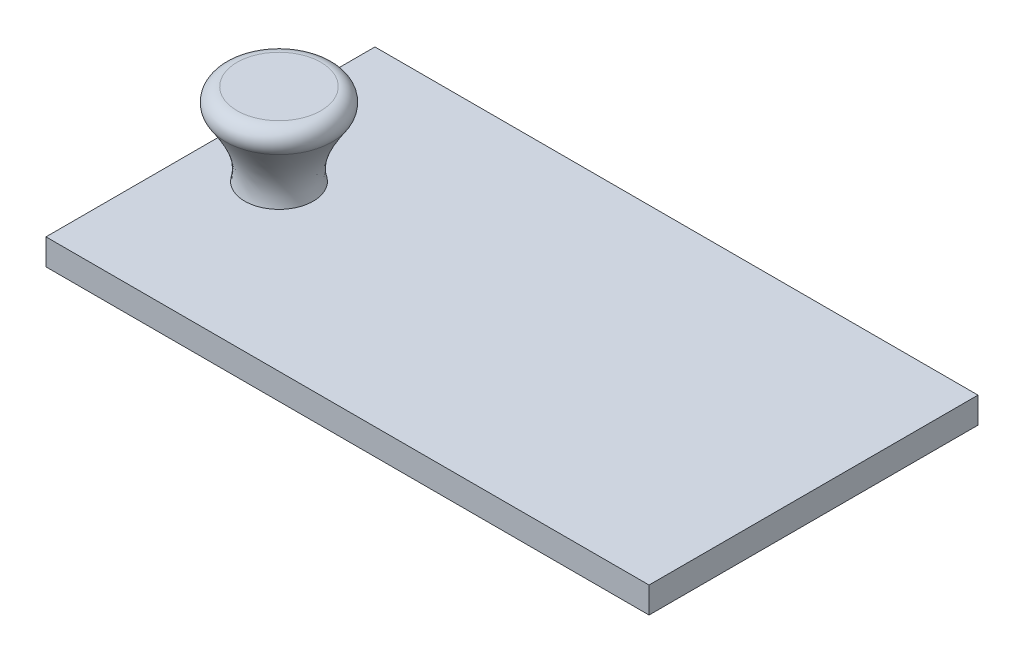
from build123d import *

# Parameters (mm, degrees)
SKETCH1_W           = 44
SKETCH1_H           = 24
BOSS_EXTRUDE1_DEPTH = 1.9
FILLET1_R           = 1


with BuildPart() as part:
    # Sketch1 → Boss-Extrude1 (new body)
    with BuildSketch(Plane(origin=(0, 0, 0), x_dir=(1, 0, 0), z_dir=(0, 1, 0))):
        Rectangle(SKETCH1_W, SKETCH1_H)
    extrude(amount=BOSS_EXTRUDE1_DEPTH)

    # Loft2: read off the stored shape, not the designer's step
    # Loft2: loft between two sections, ruled curve by curve
    loft2_from = [
        Edge.make_bspline([(-13.96783709, 7.9, 3.975674545), (-21.919186181, 7.9, 10.040000365), (-27.983512, 7.9, 2.088651274), (-20.03216291, 7.9, -3.975674545), (-12.080813819, 7.9, -10.040000365), (-6.016488, 7.9, -2.088651274), (-13.96783709, 7.9, 3.975674545)], [0, 0, 0, 0, 0.5, 0.5, 0.5, 1, 1, 1, 1], 3, [1, 0.333333333, 0.333333333, 1, 0.333333333, 0.333333333, 1]),
    ]
    loft2_to = [
        Edge.make_bspline([(-14.73827925, 1.9, -1.065185077), (-12.607909097, 1.9, 3.458256424), (-17.131350597, 1.9, 5.588626577), (-19.26172075, 1.9, 1.065185077), (-21.392090903, 1.9, -3.458256424), (-16.868649403, 1.9, -5.588626577), (-14.73827925, 1.9, -1.065185077)], [0, 0, 0, 0, 0.5, 0.5, 0.5, 1, 1, 1, 1], 3, [1, 0.333333333, 0.333333333, 1, 0.333333333, 0.333333333, 1]),
    ]
    loft2 = Solid(Shell([*[Face.make_surface_from_curves(loft2_from[k], loft2_to[k]) for k in range(1)], Face(Wire(loft2_from)), Face(Wire(loft2_to))]))
    add(loft2)

    # Fillet1
    fillet1_edges = [part.edges().sort_by_distance(p)[0] for p in [
        (-20.03216291, 7.9, -3.975674545),
    ]]
    fillet(fillet1_edges, radius=FILLET1_R)


solid = part.part
